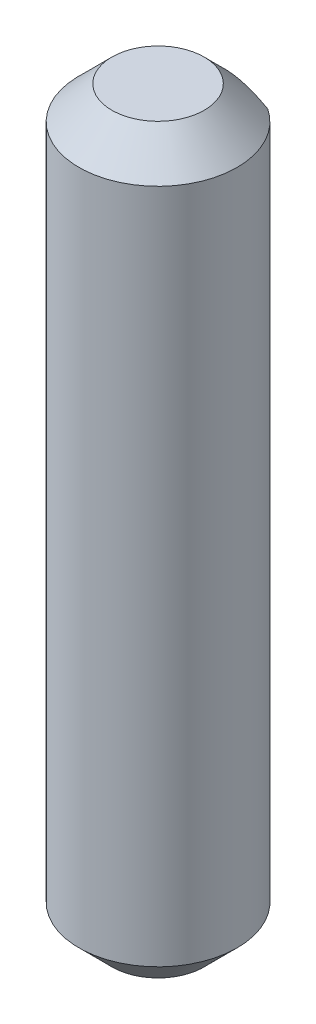
from build123d import *

# Parameters (mm, degrees)
BOSS_EXTRUDE1_DEPTH = 45


with BuildPart() as part:
    # Sketch1 → Boss-Extrude1 (new body)
    with BuildSketch(Plane(origin=(0, 0, 0), x_dir=(1, 0, 0), z_dir=(0, 1, 0))):
        with BuildLine():
            Line((-2.653299832, 4), (2.653299832, 4))
            ThreePointArc((2.653299832, 4), (0, -4.8), (-2.653299832, 4))
        make_face()
    extrude(amount=BOSS_EXTRUDE1_DEPTH)

    # Chamfer1: read off the stored shape, not the designer's step
    # Chamfer1 outline → Chamfer1 (revolve, cut)
    with BuildSketch(Plane.XY):
        Polygon((4.800000063, 2.000000063), (2.8, 0), (4.800000063, 0), align=None)
        Polygon((2.8, 45), (4.800000063, 42.999999937), (4.800000063, 45), align=None)
    revolve(axis=Axis((0, 0, 0), (0, 1, 0)), mode=Mode.SUBTRACT)


solid = part.part
